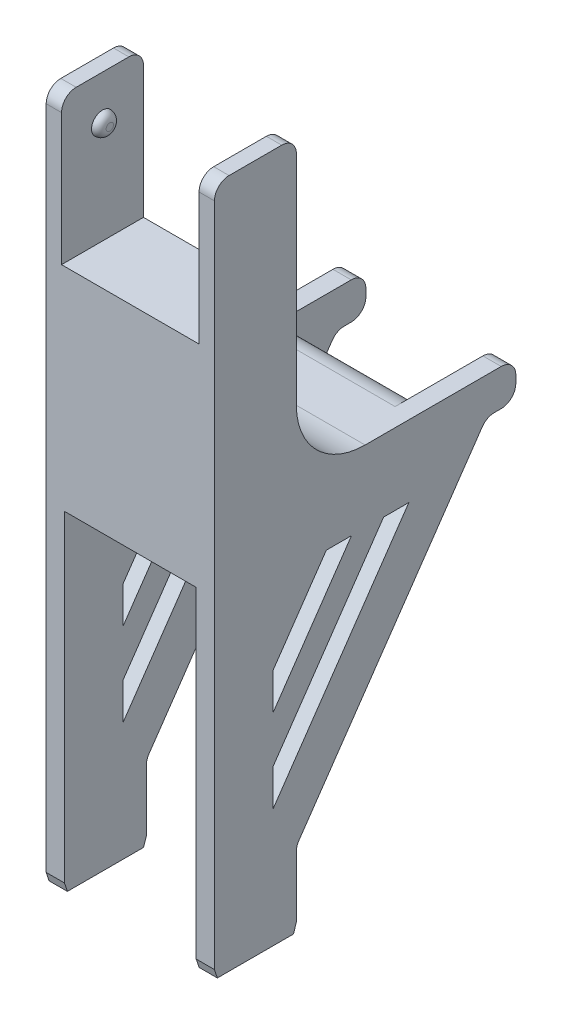
from build123d import *

# Parameters (mm, degrees)
DODANIE_WYCI_GNI_CIE1_DEPTH     = 11.5
SZKIC2_W                        = 9.4
SZKIC2_H                        = 10
SZKIC2_W_2                      = 9
SZKIC2_H_2                      = 24.370303929
WYTNIJ_WYCI_GNI_CIE1_DEPTH      = 36.480417134
WYTNIJ_WYCI_GNI_CIE2_DEPTH      = 36.480417134
WYTNIJ_WYCI_GNI_CIE2_DEPTH_BACK = 36.480417134
SZKIC4_W                        = 9
SZKIC4_H                        = 5
WYTNIJ_WYCI_GNI_CIE3_DEPTH      = 10
ZAOKR_GLENIE1_R                 = 2
ZAOKR_GLENIE2_R                 = 1
SZKIC5_R                        = 0.75
DODANIE_WYCI_GNI_CIE2_DEPTH     = 0.5
ZAOKR_GLENIE3_R                 = 0.5


# Some blends are built 0.0001 mm under size
with BuildPart() as part:
    # Szkic1 → Dodanie-wyciągnięcie1 (new body)
    with BuildSketch(Plane(origin=(0, 0, 0), x_dir=(0, 0, -1), z_dir=(1, 0, 0))):
        with BuildLine():
            Line((0, 0), (-10.3, 0))
            ThreePointArc((-10.3, 0), (-13.623401872, 1.376598128), (-15, 4.7))
            Line((-15, 4.7), (-15, 20.6))
            Line((-15, 20.6), (-20.6, 20.6))
            Line((-20.6, 20.6), (-20.6, -21.4))
            Line((-20.6, -21.4), (-20.6, -25.9))
            Line((-20.6, -25.9), (-20.4, -26.5))
            Line((-20.4, -26.5), (-15.2, -26.5))
            Line((-15.2, -26.5), (-15, -25.9))
            Line((-15, -25.9), (-15, -21.4))
            Line((-15, -21.4), (-2, -2.5))
            Line((-2, -2.5), (0, -2.5))
            Line((0, -2.5), (0, 0))
        make_face()
    extrude(amount=DODANIE_WYCI_GNI_CIE1_DEPTH)

    # Szkic2 → Wytnij-wyciągnięcie1 (cut, through all)
    with BuildSketch(Plane.XY.offset(20.6)):
        with Locations((5.75, 15.6)):
            Rectangle(SZKIC2_W, SZKIC2_H)
        with Locations((5.75, -16.085151964)):
            Rectangle(SZKIC2_W_2, SZKIC2_H_2)
    extrude(amount=-WYTNIJ_WYCI_GNI_CIE1_DEPTH, mode=Mode.SUBTRACT)

    # Szkic3 → Wytnij-wyciągnięcie2 (cut, two sides: drawn at the far end of the back side and taken through both)
    with BuildSketch(Plane(origin=(11.5, 0, 0), x_dir=(0, 0, -1), z_dir=(1, 0, 0)).offset(-WYTNIJ_WYCI_GNI_CIE2_DEPTH_BACK)):
        Polygon((-16.6, -12.705585851), (-16.6, -10.198492794), (-12.955534057, -4.9), (-11.231078515, -4.9), align=None)
        Polygon((-16.6, -15.897210923), (-16.6, -18.40430398), (-7.311325305, -4.9), (-9.035780847, -4.9), align=None)
    extrude(amount=WYTNIJ_WYCI_GNI_CIE2_DEPTH + WYTNIJ_WYCI_GNI_CIE2_DEPTH_BACK, mode=Mode.SUBTRACT)

    # Szkic4 → Wytnij-wyciągnięcie3 (cut)
    with BuildSketch(Plane(origin=(0, 0, 0), x_dir=(1, 0, 0), z_dir=(0, 1, 0))):
        with Locations((5.75, -2.5)):
            Rectangle(SZKIC4_W, SZKIC4_H)
    extrude(amount=-WYTNIJ_WYCI_GNI_CIE3_DEPTH, mode=Mode.SUBTRACT)

    # Zaokrąglenie1
    # the kernel refuses this fillet: 2 mm, written as the material it takes off along each edge
    with BuildSketch(Plane(origin=(1.25, -3.9, 5), x_dir=(0, 0, 1), z_dir=(1, 0, 0))) as zaokr_glenie1_piece_1:
        with BuildLine():
            CenterArc((ZAOKR_GLENIE1_R, -ZAOKR_GLENIE1_R), ZAOKR_GLENIE1_R, 90, 90)
            Line((0, -ZAOKR_GLENIE1_R), (0, 0))
            Line((0, 0), (ZAOKR_GLENIE1_R, 0))
        make_face()
    extrude(amount=9, mode=Mode.SUBTRACT)
    with BuildSketch(Plane(origin=(1.25, 0, 5), x_dir=(0, 0, 1), z_dir=(1, 0, 0))) as zaokr_glenie1_piece_2:
        with BuildLine():
            CenterArc((ZAOKR_GLENIE1_R, ZAOKR_GLENIE1_R), ZAOKR_GLENIE1_R, 180, 90)
            Line((0, ZAOKR_GLENIE1_R), (0, 0))
            Line((0, 0), (ZAOKR_GLENIE1_R, 0))
        make_face()
    extrude(amount=9, mode=Mode.SUBTRACT)

    # Zaokrąglenie2
    zaokr_glenie2_edges = [part.edges().sort_by_distance(p)[0] for p in [
        (0.625, 0, 0),
        (0.625, -2.5, 0),
        (0.625, -2.5, 2),
        (10.975, 20.6, 20.6),
        (10.975, 20.6, 15),
        (10.875, 0, 0),
        (10.875, -2.5, 0),
        (10.875, -2.5, 2),
        (10.875, -21.4, 15),
        (0.525, 20.6, 20.6),
        (0.525, 20.6, 15),
        (0.625, -21.4, 15),
    ]]
    fillet(zaokr_glenie2_edges, radius=ZAOKR_GLENIE2_R)

    # Szkic5 → Dodanie-wyciągnięcie2 (add)
    with BuildSketch(Plane.ZY.offset(-10.45)):
        with Locations(Location((17.8, 17.6, 0), (0, 0, 90))):
            Circle(SZKIC5_R)
    extrude(amount=DODANIE_WYCI_GNI_CIE2_DEPTH)

    # Zaokrąglenie3
    zaokr_glenie3_edges = [part.edges().sort_by_distance(p)[0] for p in [
        (9.95, 16.85, 17.8),
    ]]
    fillet(zaokr_glenie3_edges, radius=ZAOKR_GLENIE3_R - 0.0001)  # a hair under: the kernel refuses the full size

    # Lustro2: part across plane


with BuildPart() as part_1:
    add(part.part)
    add(part.part.mirror(Plane(origin=(5.75, 0, 0), x_dir=(0, 0, 1), z_dir=(1, 0, 0))))


solid = part_1.part
